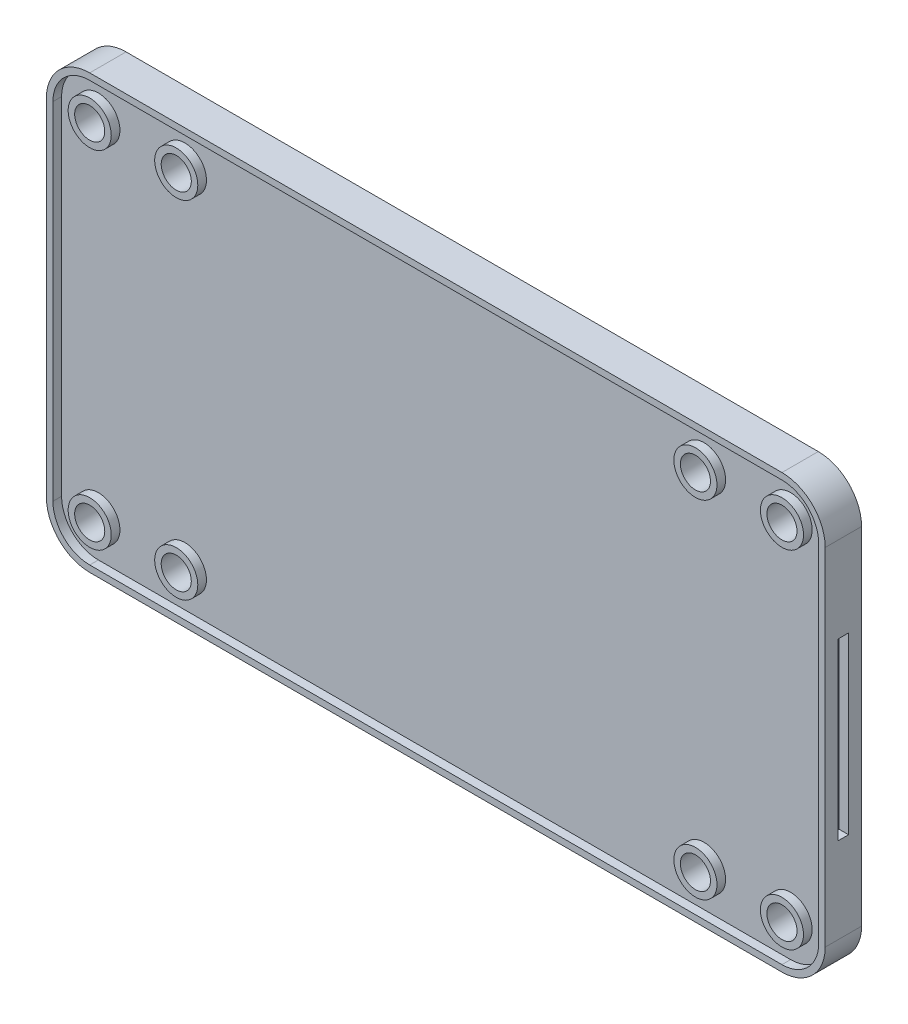
from build123d import *
from build123d.topology import SkipClean

# Parameters (mm, degrees)
SKETCH1_R           = 2.2098
BOSS_EXTRUDE1_DEPTH = 3.175
SKETCH2_R           = 3.1623
CUT_EXTRUDE3_DEPTH  = 1.27
SKETCH3_R           = 2.2098
BOSS_EXTRUDE2_DEPTH = 2.159
SKETCH4_W           = 1.524
SKETCH4_H           = 25.654
CUT_EXTRUDE4_DEPTH  = 1.397


with BuildPart() as part:
    # Sketch1 → Boss-Extrude1 (new body)
    with BuildSketch(Plane.XY):
        with BuildLine():
            Line((-50.8, -31.75), (50.8, -31.75))
            ThreePointArc((50.8, -31.75), (55.290128061, -29.890128061), (57.15, -25.4))
            Line((57.15, -25.4), (57.15, 25.4))
            ThreePointArc((57.15, 25.4), (55.290128061, 29.890128061), (50.8, 31.75))
            Line((50.8, 31.75), (-50.8, 31.75))
            ThreePointArc((-50.8, 31.75), (-55.290128061, 29.890128061), (-57.15, 25.4))
            Line((-57.15, 25.4), (-57.15, -25.4))
            ThreePointArc((-57.15, -25.4), (-55.290128061, -29.890128061), (-50.8, -31.75))
        make_face()
        with Locations((-50.8, -25.4)):
            Circle(SKETCH1_R, mode=Mode.SUBTRACT)
        with Locations((-38.1, -25.4)):
            Circle(SKETCH1_R, mode=Mode.SUBTRACT)
        with Locations((-50.8, 25.4)):
            Circle(SKETCH1_R, mode=Mode.SUBTRACT)
        with Locations((-38.1, 25.4)):
            Circle(SKETCH1_R, mode=Mode.SUBTRACT)
        with Locations((50.8, 25.4)):
            Circle(SKETCH1_R, mode=Mode.SUBTRACT)
        with Locations((38.1, 25.4)):
            Circle(SKETCH1_R, mode=Mode.SUBTRACT)
        with Locations((50.8, -25.4)):
            Circle(SKETCH1_R, mode=Mode.SUBTRACT)
        with Locations((38.1, -25.4)):
            Circle(SKETCH1_R, mode=Mode.SUBTRACT)
    extrude(amount=-BOSS_EXTRUDE1_DEPTH)

    # Sketch2 → Cut-Extrude3 (cut)
    with BuildSketch(Plane.XY):
        with BuildLine():
            Line((50.8, 30.7975), (-50.8, 30.7975))
            ThreePointArc((-50.8, 30.7975), (-54.616608851, 29.216608851), (-56.1975, 25.4))
            Line((-56.1975, 25.4), (-56.1975, -25.4))
            ThreePointArc((-56.1975, -25.4), (-54.616608851, -29.216608851), (-50.8, -30.7975))
            Line((-50.8, -30.7975), (50.8, -30.7975))
            ThreePointArc((50.8, -30.7975), (54.616608851, -29.216608851), (56.1975, -25.4))
            Line((56.1975, -25.4), (56.1975, 25.4))
            ThreePointArc((56.1975, 25.4), (54.616608851, 29.216608851), (50.8, 30.7975))
        make_face()
        with Locations((38.1, 25.4)):
            Circle(SKETCH2_R, mode=Mode.SUBTRACT)
        with Locations((50.8, 25.4)):
            Circle(SKETCH2_R, mode=Mode.SUBTRACT)
        with Locations((50.8, -25.4)):
            Circle(SKETCH2_R, mode=Mode.SUBTRACT)
        with Locations((38.1, -25.4)):
            Circle(SKETCH2_R, mode=Mode.SUBTRACT)
        with Locations((-38.1, -25.4)):
            Circle(SKETCH2_R, mode=Mode.SUBTRACT)
        with Locations((-50.8, -25.4)):
            Circle(SKETCH2_R, mode=Mode.SUBTRACT)
        with Locations((-38.1, 25.4)):
            Circle(SKETCH2_R, mode=Mode.SUBTRACT)
        with Locations((-50.8, 25.4)):
            Circle(SKETCH2_R, mode=Mode.SUBTRACT)
    extrude(amount=-CUT_EXTRUDE3_DEPTH, mode=Mode.SUBTRACT)

    # Sketch3 → Boss-Extrude2 (add)
    with SkipClean():  # the faces are left unmerged after this step: merging them gives an invalid solid
        with BuildSketch(Plane(origin=(0, 0, -3.175), x_dir=(-1, 0, 0), z_dir=(0, 0, -1))):
            with BuildLine():
                Line((-57.15, 25.4), (-57.15, -25.4))
                ThreePointArc((-57.15, -25.4), (-55.290128061, -29.890128061), (-50.8, -31.75))
                Line((-50.8, -31.75), (50.8, -31.75))
                ThreePointArc((50.8, -31.75), (55.290128061, -29.890128061), (57.15, -25.4))
                Line((57.15, -25.4), (57.15, 25.4))
                ThreePointArc((57.15, 25.4), (55.290128061, 29.890128061), (50.8, 31.75))
                Line((50.8, 31.75), (-50.8, 31.75))
                ThreePointArc((-50.8, 31.75), (-55.290128061, 29.890128061), (-57.15, 25.4))
            make_face()
            with Locations((-50.8, -25.4)):
                Circle(SKETCH3_R, mode=Mode.SUBTRACT)
            with Locations((-38.1, -25.4)):
                Circle(SKETCH3_R, mode=Mode.SUBTRACT)
            with Locations((38.1, -25.4)):
                Circle(SKETCH3_R, mode=Mode.SUBTRACT)
            with Locations((50.8, -25.4)):
                Circle(SKETCH3_R, mode=Mode.SUBTRACT)
            with Locations((50.8, 25.4)):
                Circle(SKETCH3_R, mode=Mode.SUBTRACT)
            with Locations((38.1, 25.4)):
                Circle(SKETCH3_R, mode=Mode.SUBTRACT)
            with Locations((-38.1, 25.4)):
                Circle(SKETCH3_R, mode=Mode.SUBTRACT)
            with Locations((-50.8, 25.4)):
                Circle(SKETCH3_R, mode=Mode.SUBTRACT)
        extrude(amount=BOSS_EXTRUDE2_DEPTH)

    # Sketch4 → Cut-Extrude4 (cut)
    with SkipClean():  # the faces are left unmerged after this step: merging them gives an invalid solid
        with BuildSketch(Plane(origin=(57.15, 0, 0), x_dir=(0, 0, -1), z_dir=(1, 0, 0))):
            with Locations((2.667, 0)):
                Rectangle(SKETCH4_W, SKETCH4_H)
        cut_extrude4 = extrude(amount=-CUT_EXTRUDE4_DEPTH, mode=Mode.SUBTRACT)

    # Mirror1: Cut-Extrude4 across plane
    with SkipClean():  # the faces are left unmerged after this step: merging them gives an invalid solid
        add(cut_extrude4.mirror(Plane(origin=(0, 0, 0), x_dir=(0, 0, 1), z_dir=(1, 0, 0))), mode=Mode.SUBTRACT)


solid = part.part
